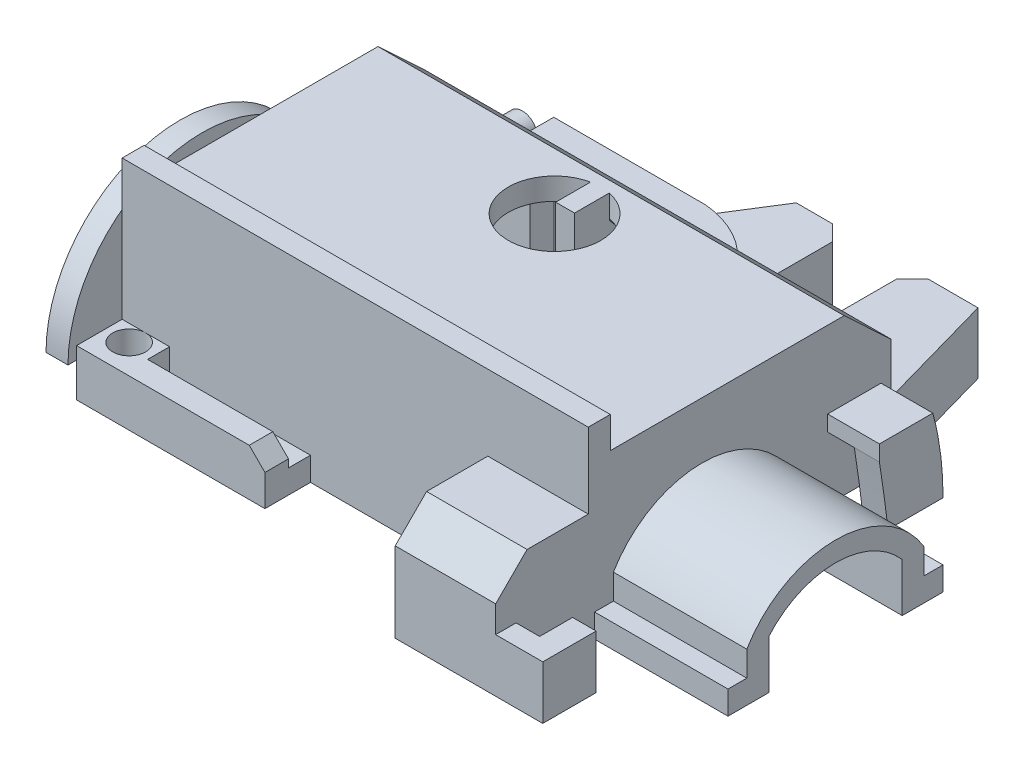
from build123d import *

# Parameters (mm, degrees)
SKETCH1_W            = 29.7
SKETCH1_H            = 19.3
BOSS_EXTRUDE1_DEPTH  = 9.9
SKETCH2_W            = 23.1
SKETCH2_H            = 3.9
BOSS_EXTRUDE3_DEPTH  = 7.7
CUT_EXTRUDE1_DEPTH   = 24.612390815
BOSS_EXTRUDE4_DEPTH  = 3.2
BOSS_EXTRUDE5_DEPTH  = 3.9
SKETCH7_R            = 0.95
BOSS_EXTRUDE6_DEPTH  = 2.9
BOSS_EXTRUDE8_DEPTH  = 8.5
SKETCH10_W           = 12
SKETCH10_H           = 3
BOSS_EXTRUDE9_DEPTH  = 2.9
SKETCH11_W           = 8.976509782
SKETCH11_H           = 1.4
CUT_EXTRUDE2_DEPTH   = 1.5
SKETCH14_R           = 1.05
CUT_EXTRUDE3_DEPTH   = 30.897407914
SKETCH15_W           = 6.4
SKETCH15_H           = 7.1
BOSS_EXTRUDE10_DEPTH = 5.9
SKETCH16_W           = 1.3
SKETCH16_H           = 3.4
BOSS_EXTRUDE11_DEPTH = 3
SKETCH17_W           = 3.4
SKETCH17_H           = 3.4
BOSS_EXTRUDE12_DEPTH = 1.5
BOSS_EXTRUDE13_DEPTH = 2.2
BOSS_EXTRUDE15_DEPTH = 1.4
SKETCH21_W           = 29.7
SKETCH21_H           = 1.4
BOSS_EXTRUDE16_DEPTH = 2
SHELL1_OUTLINE_W     = 26.9
SHELL1_OUTLINE_H     = 16.5
SHELL1_DEPTH         = 8.5
SHELL1_2_OUTLINE_W   = 3.6
SHELL1_2_OUTLINE_H   = 5.9
SHELL1_2_DEPTH       = 2.5
SHELL1_START         = 2.5
SHELL1_3_OUTLINE_W   = 3.6
SHELL1_3_OUTLINE_H   = 5.9
SHELL1_3_DEPTH       = 3.2
SHELL1_4_DEPTH       = 0.1
SHELL1_START_2       = 0.1
SHELL1_5_DEPTH       = 1.5
CUT_EXTRUDE5_START   = -2
CUT_EXTRUDE5_DEPTH   = 2
CUT_EXTRUDE6_DEPTH   = 2
BOSS_EXTRUDE17_DEPTH = 3.3
SKETCH26_W           = 1.7
SKETCH26_H           = 3.040173169
CUT_EXTRUDE8_DEPTH   = 4
SKETCH32_R           = 1.35
SKETCH32_R_2         = 0.85
BOSS_EXTRUDE22_DEPTH = 5.7
SKETCH33_R           = 1.35
SKETCH33_R_2         = 0.85
BOSS_EXTRUDE23_DEPTH = 2.5
SKETCH34_R           = 1.2
SKETCH34_R_2         = 0.7
BOSS_EXTRUDE24_DEPTH = 8.5
SKETCH35_R           = 2.95
CUT_EXTRUDE9_DEPTH   = 4
CHAMFER1_SIZE2       = 3
CHAMFER1_SIZE        = 2.8
CHAMFER2_SIZE        = 1
CHAMFER3_SIZE        = 1
CHAMFER4_SIZE        = 2
SKETCH36_W           = 1.2
SKETCH36_H           = 6.025951521
BOSS_EXTRUDE25_DEPTH = 3.2
BOSS_EXTRUDE33_START = -4.2
BOSS_EXTRUDE33_DEPTH = 4.2
BOSS_EXTRUDE36_DEPTH = 2.5
CHAMFER5_SIZE        = 2.2
CHAMFER5_SIZE_2      = 2.7
CHAMFER6_SIZE        = 2.7
CHAMFER6_SIZE2       = 2.2


# Read off the part's stored shape, not the designer's step: Shell1
# Some blends are built 0.0001 mm under size
with BuildPart() as part:
    # Sketch1 → Boss-Extrude1 (new body)
    with BuildSketch(Plane(origin=(0, 0, 0), x_dir=(1, 0, 0), z_dir=(0, 1, 0))):
        Rectangle(SKETCH1_W, SKETCH1_H)
    extrude(amount=BOSS_EXTRUDE1_DEPTH)

    # Sketch2 → Boss-Extrude3 (add)
    with BuildSketch(Plane(origin=(0, 0, -9.65), x_dir=(-1, 0, 0), z_dir=(0, 0, -1))):
        with Locations((-3.3, 1.95)):
            Rectangle(SKETCH2_W, SKETCH2_H)
    extrude(amount=BOSS_EXTRUDE3_DEPTH)

    # Sketch4 → Cut-Extrude1 (cut, through all)
    with BuildSketch(Plane(origin=(0, 3.9, 0), x_dir=(1, 0, 0), z_dir=(0, 1, 0))):
        with BuildLine():
            Line((8.5, 12.25), (8.5, 17.35))
            Line((8.5, 17.35), (4.4, 17.35))
            Line((4.4, 17.35), (4.4, 12.25))
            ThreePointArc((4.4, 12.25), (6.45, 10.2), (8.5, 12.25))
        make_face()
        Polygon((14.85, 9.65), (12.679746559, 17.35), (14.85, 17.35), align=None)
        Polygon((1.1, 17.35), (-3.75, 9.65), (-8.25, 9.65), (-8.25, 17.35), align=None)
    extrude(amount=-CUT_EXTRUDE1_DEPTH, mode=Mode.SUBTRACT)

    # Sketch5 → Boss-Extrude4 (add)
    with BuildSketch(Plane(origin=(0, 3.9, 0), x_dir=(1, 0, 0), z_dir=(0, 1, 0))):
        with BuildLine():
            Line((-8.15, 9.65), (5.05, 9.65))
            ThreePointArc((5.05, 9.65), (3.409161026, 10.676894337), (1.53218592, 11.15))
            Line((1.53218592, 11.15), (-8.15, 11.15))
            Line((-8.15, 11.15), (-8.15, 9.65))
        make_face()
    extrude(amount=BOSS_EXTRUDE4_DEPTH)

    # Sketch6 → Boss-Extrude5 (add)
    with BuildSketch(Plane.XZ.offset(-3.9)):
        Polygon((-8.15, -9.65), (-8.15, -11.15), (-2.805194805, -11.15), (-3.75, -9.65), align=None)
    extrude(amount=BOSS_EXTRUDE5_DEPTH)

    # Sketch7 → Boss-Extrude6 (add)
    with BuildSketch(Plane(origin=(0, 0, -9.65), x_dir=(-1, 0, 0), z_dir=(0, 0, -1))):
        with Locations(Location((11.55, 4.1, 0), (0, 0, 180))):
            Circle(SKETCH7_R)
    extrude(amount=BOSS_EXTRUDE6_DEPTH)

    # Sketch8 → Boss-Extrude8 (add)
    with BuildSketch(Plane(origin=(14.85, 0, 0), x_dir=(0, 0, -1), z_dir=(1, 0, 0))):
        with BuildLine():
            Line((4.45, 0), (1.85, 0))
            Line((1.85, 0), (1.85, 1.5))
            Line((1.85, 1.5), (1.85, 3.1))
            ThreePointArc((1.85, 3.1), (-2.4, 5.040092727), (-6.65, 3.1))
            Line((-6.65, 3.1), (-6.65, 1.5))
            Line((-6.65, 1.5), (-6.65, 0))
            Line((-6.65, 0), (-9.25, 0))
            Line((-9.25, 0), (-9.25, 1.5))
            Line((-9.25, 1.5), (-8.05, 1.5))
            Line((-8.05, 1.5), (-8.05, 3.1))
            ThreePointArc((-8.05, 3.1), (-2.4, 6.300419583), (3.25, 3.1))
            Line((3.25, 3.1), (3.25, 1.5))
            Line((3.25, 1.5), (4.45, 1.5))
            Line((4.45, 1.5), (4.45, 0))
        make_face()
    extrude(amount=BOSS_EXTRUDE8_DEPTH)

    # Sketch10 → Boss-Extrude9 (add)
    with BuildSketch(Plane.XY.offset(9.65)):
        with Locations((-8.85, 1.5)):
            Rectangle(SKETCH10_W, SKETCH10_H)
    extrude(amount=BOSS_EXTRUDE9_DEPTH)

    # Sketch11 → Cut-Extrude2 (cut)
    with BuildSketch(Plane(origin=(0, 3, 0), x_dir=(1, 0, 0), z_dir=(0, 1, 0))):
        with Locations((-7.338254891, -10.35)):
            Rectangle(SKETCH11_W, SKETCH11_H)
    extrude(amount=-CUT_EXTRUDE2_DEPTH, mode=Mode.SUBTRACT)

    # Sketch14 → Cut-Extrude3 (cut, through all)
    with BuildSketch(Plane(origin=(0, 3, 0), x_dir=(1, 0, 0), z_dir=(0, 1, 0))):
        with Locations(Location((-13.35, -10.7, 0), (0, 0, 270))):
            Circle(SKETCH14_R)
    extrude(amount=-CUT_EXTRUDE3_DEPTH, mode=Mode.SUBTRACT)

    # Sketch15 → Boss-Extrude10 (add)
    with BuildSketch(Plane.XY.offset(9.65)):
        with Locations((11.65, 3.55)):
            Rectangle(SKETCH15_W, SKETCH15_H)
    extrude(amount=BOSS_EXTRUDE10_DEPTH)

    # Sketch16 → Boss-Extrude11 (add)
    with BuildSketch(Plane(origin=(14.85, 0, 0), x_dir=(0, 0, -1), z_dir=(1, 0, 0))):
        with Locations((-14.9, 1.7)):
            Rectangle(SKETCH16_W, SKETCH16_H)
    extrude(amount=BOSS_EXTRUDE11_DEPTH)

    # Sketch17 → Boss-Extrude12 (add)
    with BuildSketch(Plane(origin=(17.85, 0, 0), x_dir=(0, 0, -1), z_dir=(1, 0, 0))):
        with Locations((-13.85, 1.7)):
            Rectangle(SKETCH17_W, SKETCH17_H)
    extrude(amount=-BOSS_EXTRUDE12_DEPTH)

    # Sketch19 → Boss-Extrude13 (add)
    with BuildSketch(Plane.ZY.offset(14.85)):
        with BuildLine():
            Line((-2.2, 0), (-0.65, 0))
            ThreePointArc((-0.65, 0), (2.35, 3), (5.35, 0))
            Line((5.35, 0), (6.9, 0))
            ThreePointArc((6.9, 0), (2.35, 4.55), (-2.2, 0))
        make_face()
    extrude(amount=BOSS_EXTRUDE13_DEPTH)

    # Sketch20 → Boss-Extrude15 (add)
    with BuildSketch(Plane.ZY.offset(17.05)):
        with BuildLine():
            ThreePointArc((10.9, 0), (2.35, 8.55), (-6.2, 0))
            Line((-6.2, 0), (-2.2, 0))
            Line((-2.2, 0), (-0.65, 0))
            ThreePointArc((-0.65, 0), (2.35, 3), (5.35, 0))
            Line((5.35, 0), (6.9, 0))
            Line((6.9, 0), (10.9, 0))
        make_face()
    extrude(amount=BOSS_EXTRUDE15_DEPTH)

    # Sketch21 → Boss-Extrude16 (add)
    with BuildSketch(Plane(origin=(0, 9.9, 0), x_dir=(1, 0, 0), z_dir=(0, 1, 0))):
        with Locations((0, -8.95)):
            Rectangle(SKETCH21_W, SKETCH21_H)
    extrude(amount=BOSS_EXTRUDE16_DEPTH)

    # Shell1 outline → Shell1 (cut)
    with BuildSketch(Plane(origin=(0, 0, 0), x_dir=(1, 0, 0), z_dir=(0, 1, 0))):
        Rectangle(SHELL1_OUTLINE_W, SHELL1_OUTLINE_H)
    extrude(amount=SHELL1_DEPTH, mode=Mode.SUBTRACT)

    # Shell1 2 outline → Shell1 2 (cut)
    with BuildSketch(Plane(origin=(0, 0, 0), x_dir=(1, 0, 0), z_dir=(0, 1, 0))):
        with Locations((11.65, -11.2)):
            Rectangle(SHELL1_2_OUTLINE_W, SHELL1_2_OUTLINE_H)
        with BuildLine():
            Line((13.45, 8.25), (13.45, 9.456474215))
            Line((13.45, 9.456474215), (11.619792639, 15.95))
            Line((11.619792639, 15.95), (9.9, 15.95))
            Line((9.9, 15.95), (9.9, 12.25))
            ThreePointArc((9.9, 12.25), (6.45, 8.8), (3, 12.25))
            Line((3, 12.25), (3, 15.95))
            Line((3, 15.95), (1.872752248, 15.95))
            Line((1.872752248, 15.95), (-2.032442558, 9.75))
            Line((-2.032442558, 9.75), (-6.75, 9.75))
            Line((-6.75, 9.75), (-6.75, 8.25))
            Line((-6.75, 8.25), (13.45, 8.25))
        make_face()
    extrude(amount=SHELL1_2_DEPTH, mode=Mode.SUBTRACT)

    # Shell1 3 outline → Shell1 3 (cut)
    with BuildSketch(Plane(origin=(0, 0, 0), x_dir=(1, 0, 0), z_dir=(0, 1, 0)).offset(SHELL1_START)):
        with Locations((11.65, -11.2)):
            Rectangle(SHELL1_3_OUTLINE_W, SHELL1_3_OUTLINE_H)
        with BuildLine():
            Line((-6.75, 8.25), (4.488078335, 8.25))
            ThreePointArc((4.488078335, 8.25), (3.111788225, 9.273075846), (1.464547501, 9.75))
            Line((1.464547501, 9.75), (-6.75, 9.75))
            Line((-6.75, 9.75), (-6.75, 8.25))
        make_face()
    extrude(amount=SHELL1_3_DEPTH, mode=Mode.SUBTRACT)

    # Shell1 4 outline → Shell1 4 (cut)
    with BuildSketch(Plane(origin=(0, 0, 0), x_dir=(1, 0, 0), z_dir=(0, 1, 0))):
        with BuildLine():
            Line((-4.25, -11.15), (-4.25, -8.25))
            Line((-4.25, -8.25), (-13.35, -8.25))
            ThreePointArc((-13.35, -8.25), (-11.465192318, -9.134752416), (-10.941681084, -11.15))
            Line((-10.941681084, -11.15), (-4.25, -11.15))
        make_face()
        with BuildLine():
            ThreePointArc((-13.45, -8.252041667), (-13.40001042, -8.25051047), (-13.35, -8.25))
            Line((-13.35, -8.25), (-13.45, -8.25))
            Line((-13.45, -8.25), (-13.45, -8.252041667))
        make_face()
    extrude(amount=SHELL1_4_DEPTH, mode=Mode.SUBTRACT)

    # Shell1 5 outline → Shell1 5 (cut)
    with BuildSketch(Plane(origin=(0, 0, 0), x_dir=(1, 0, 0), z_dir=(0, 1, 0)).offset(SHELL1_START_2)):
        with BuildLine():
            Line((-13.226509782, -8.25311419), (-13.226509782, -8.25))
            Line((-13.226509782, -8.25), (-13.35, -8.25))
            ThreePointArc((-13.35, -8.25), (-13.288235261, -8.250778671), (-13.226509782, -8.25311419))
        make_face()
        with BuildLine():
            ThreePointArc((-13.45, -8.252041667), (-13.40001042, -8.25051047), (-13.35, -8.25))
            Line((-13.35, -8.25), (-13.45, -8.25))
            Line((-13.45, -8.25), (-13.45, -8.252041667))
        make_face()
    extrude(amount=SHELL1_5_DEPTH, mode=Mode.SUBTRACT)

    # Sketch23 → Cut-Extrude5 (cut)
    with BuildSketch(Plane.ZY.offset(14.85).offset(CUT_EXTRUDE5_START)):
        with BuildLine():
            Line((-0.65, 0), (5.35, 0))
            ThreePointArc((5.35, 0), (2.35, 3), (-0.65, 0))
        make_face()
    extrude(amount=CUT_EXTRUDE5_DEPTH, mode=Mode.SUBTRACT)

    # Sketch24 → Cut-Extrude6 (cut)
    with BuildSketch(Plane(origin=(14.85, 0, 0), x_dir=(0, 0, -1), z_dir=(1, 0, 0))):
        with BuildLine():
            Line((-4.4, 0), (-0.4, 0))
            ThreePointArc((-0.4, 0), (-2.4, 2), (-4.4, 0))
        make_face()
    extrude(amount=-CUT_EXTRUDE6_DEPTH, mode=Mode.SUBTRACT)

    # Sketch25 → Boss-Extrude17 (add)
    with BuildSketch(Plane(origin=(14.85, 0, 0), x_dir=(0, 0, -1), z_dir=(1, 0, 0))):
        with BuildLine():
            Line((9.65, 0), (6.15, 0))
            add(Edge.make_bspline(
                [(5.6, 4), (5.912494259, 2.005178445), (6.15, 0)],
                knots=[0, 0, 0, 1, 1, 1], degree=2))
            Line((5.6, 4), (5.6, 5))
            Line((5.6, 5), (9, 5))
            add(Edge.make_bspline(
                [(9, 5), (9.662826285, 2.545299606), (9.65, 0)],
                knots=[0, 0, 0, 1, 1, 1], degree=2))
        make_face()
    extrude(amount=BOSS_EXTRUDE17_DEPTH)

    # Sketch26 → Cut-Extrude8 (cut)
    with BuildSketch(Plane.XZ):
        with Locations((15.7, -6.629913416)):
            Rectangle(SKETCH26_W, SKETCH26_H)
    extrude(amount=-CUT_EXTRUDE8_DEPTH, mode=Mode.SUBTRACT)

    # Sketch32 → Boss-Extrude22 (add)
    with BuildSketch(Plane.XZ.offset(-5.7)):
        with Locations(Location((11.665452924, 9.6, 0), (0, 0, 90))):
            Circle(SKETCH32_R)
        with Locations(Location((11.665452924, 9.6, 0), (0, 0, 90))):
            Circle(SKETCH32_R_2, mode=Mode.SUBTRACT)
    extrude(amount=BOSS_EXTRUDE22_DEPTH)

    # Sketch33 → Boss-Extrude23 (add)
    with BuildSketch(Plane.XZ.offset(-2.5)):
        with Locations(Location((11.342898785, -11.75, 0), (0, 0, 90))):
            Circle(SKETCH33_R)
        with Locations(Location((11.342898785, -11.75, 0), (0, 0, 90))):
            Circle(SKETCH33_R_2, mode=Mode.SUBTRACT)
    extrude(amount=BOSS_EXTRUDE23_DEPTH)

    # Sketch34 → Boss-Extrude24 (add)
    with BuildSketch(Plane.XZ.offset(-8.5)):
        with Locations(Location((-12.21310403, -6.709558041, 0), (0, 0, 90))):
            Circle(SKETCH34_R)
        with Locations(Location((-12.21310403, -6.709558041, 0), (0, 0, 90))):
            Circle(SKETCH34_R_2, mode=Mode.SUBTRACT)
    extrude(amount=BOSS_EXTRUDE24_DEPTH)

    # Sketch35 → Cut-Extrude9 (cut)
    with BuildSketch(Plane.XZ.offset(-8.5)):
        with Locations(Location((0, -3.05, 0), (0, 0, 270))):
            Circle(SKETCH35_R)
    extrude(amount=-CUT_EXTRUDE9_DEPTH, mode=Mode.SUBTRACT)

    # Chamfer1
    chamfer1_edges = [part.edges().sort_by_distance(p)[0] for p in [
        (0, 9.9, -9.65),
    ]]
    chamfer1_side = [part.faces().sort_by_distance(p)[0] for p in [
        (0, 9.844, -9.65),
    ]]
    chamfer(chamfer1_edges, length=CHAMFER1_SIZE - 0.0001, length2=CHAMFER1_SIZE2 - 0.0001, reference=chamfer1_side[0])  # a hair under: the kernel refuses the full size

    # Chamfer2
    chamfer2_edges = [part.edges().sort_by_distance(p)[0] for p in [
        (4.4, 1.95, -17.35),
        (8.5, 1.95, -17.35),
    ]]
    chamfer(chamfer2_edges, length=CHAMFER2_SIZE)

    # Chamfer3
    chamfer3_edges = [part.edges().sort_by_distance(p)[0] for p in [
        (-2.85, 3, 11.8),
    ]]
    chamfer(chamfer3_edges, length=CHAMFER3_SIZE)

    # Chamfer4
    chamfer4_edges = [part.edges().sort_by_distance(p)[0] for p in [
        (11.65, 7.1, 15.55),
    ]]
    chamfer(chamfer4_edges, length=CHAMFER4_SIZE)

    # Sketch36 → Boss-Extrude25 (add)
    with BuildSketch(Plane.XZ.offset(-2.5)):
        with Locations((0, -6.73702424)):
            Rectangle(SKETCH36_W, SKETCH36_H)
    extrude(amount=-BOSS_EXTRUDE25_DEPTH)

    # Sketch39 → Boss-Extrude33 (add)
    with BuildSketch(Plane(origin=(0, 9.9, 0), x_dir=(1, 0, 0), z_dir=(0, 1, 0)).offset(BOSS_EXTRUDE33_START)):
        with BuildLine():
            Line((-0.6, 3.724048479), (0.6, 3.724048479))
            Line((0.6, 3.724048479), (0.6, 5.938338623))
            ThreePointArc((0.6, 5.938338623), (0, 6), (-0.6, 5.938338623))
            Line((-0.6, 5.938338623), (-0.6, 3.724048479))
        make_face()
    extrude(amount=BOSS_EXTRUDE33_DEPTH)

    # Sketch42 → Boss-Extrude36 (add)
    with BuildSketch(Plane.XZ.offset(-2.5)):
        Polygon((0.6, -12.012795022), (0.6, -13.908363861), (-0.6, -12.012795022), (-0.6, -3.724048479), (0.6, -3.724048479), align=None)
    extrude(amount=BOSS_EXTRUDE36_DEPTH)

    # Chamfer5
    # the kernel refuses this chamfer: 2.7, 2.2 mm, written as the material it adds along each edge
    with BuildSketch(Plane(origin=(13.45, 8.5, -8.25), x_dir=(0, 0.036887238791768716, 0.9993194342222707), z_dir=(-1, 0, 0))) as chamfer5_piece_1_section:
        Polygon((CHAMFER5_SIZE * 0.999319434222, -CHAMFER5_SIZE * 0.0368872387918), (-CHAMFER5_SIZE_2 * 0.0368872387918, -CHAMFER5_SIZE_2 * 0.999319434222), (0, 0), align=None)
    chamfer5_piece_1 = extrude(amount=26.9, mode=Mode.PRIVATE)
    chamfer5_piece_1 = split(chamfer5_piece_1, bisect_by=Plane(origin=(0.622533922, 8.383179545, -8.275268643), z_dir=(0, -0.7310560786244812, 0.6823173820929644)), keep=Keep.TOP, mode=Mode.PRIVATE)
    chamfer5_piece_1 = chamfer5_piece_1 - Plane(origin=(-12.21310403, 7.587854382, -6.709558041), x_dir=(0, 0, 1), z_dir=(0, 1, 0)) * Cylinder(0.7, 65, mode=Mode.PRIVATE)
    add(chamfer5_piece_1)

    # Chamfer6
    chamfer6_edges = [part.edges().sort_by_distance(p)[0] for p in [
        (0, 5.7, -6),
    ]]
    chamfer6_side = [part.faces().sort_by_distance(p)[0] for p in [
        (0, 7.1, -6),
    ]]
    chamfer(chamfer6_edges, length=CHAMFER6_SIZE, length2=CHAMFER6_SIZE2, reference=chamfer6_side[0])


solid = part.part
